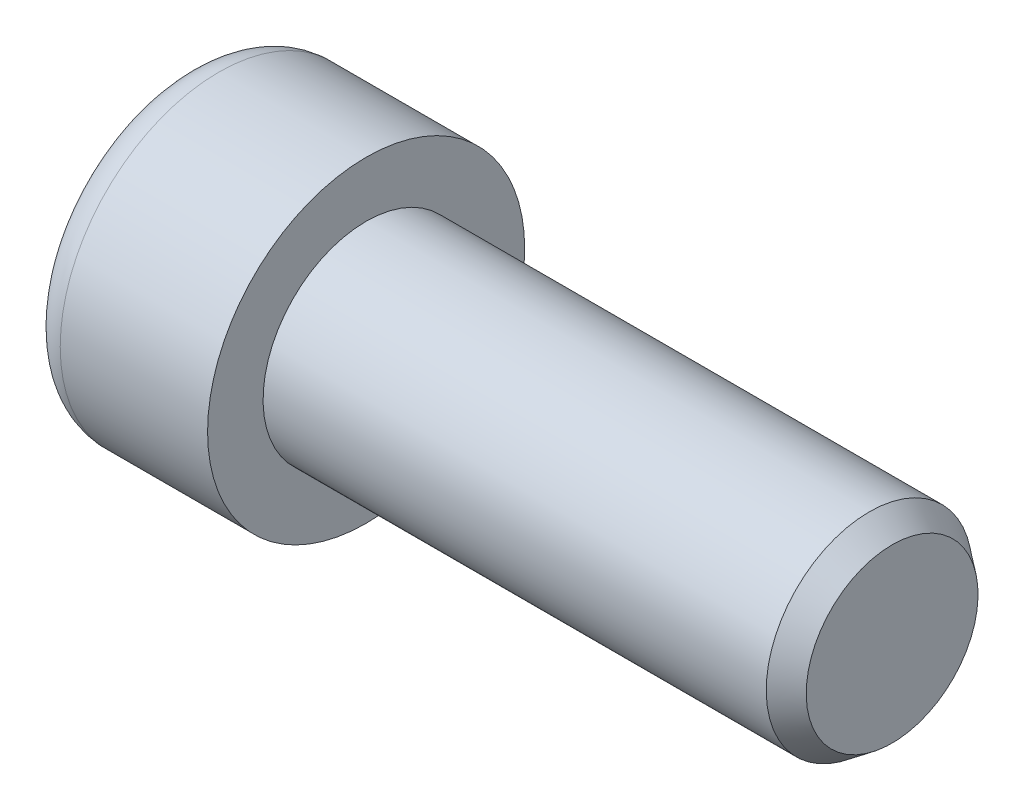
from build123d import *

# Parameters (mm, degrees)
ENL_V_MAT_EXTRU_1_DEPTH = 3
CONG_1_R                = 1


with BuildPart() as part:
    # Esquisse1 → Révolution1 (revolve)
    with BuildSketch(Plane(origin=(0, 331.163762518, 486.544521424), x_dir=(1, 0, 0), z_dir=(-2.1801348268776946e-15, -0.26285670928101523, -0.9648348824467097))):
        Polygon((-260.2005836, 66.110103574), (-260.2005836, 68.610660843), (-260.864838185, 69.110103574), (-275.510043652, 69.110103574), (-275.510043652, 70.725166096), (-280.798930196, 70.725166096), (-280.798930196, 66.110103574), align=None)
    revolve(axis=Axis((-255.510043652, 267.378428507, 503.922005699), (-1, 0, 0)))

    # Esquisse2 → Enlèv. mat.-Extru.1 (cut)
    with BuildSketch(Plane.ZY.offset(280.798930196)):
        Polygon((506.151783926, 267.979612665), (504.51625406, 269.610065175), (502.286475833, 269.008881018), (501.692227472, 266.777244349), (503.327757339, 265.146791839), (505.557535566, 265.747975996), align=None)
    extrude(amount=-ENL_V_MAT_EXTRU_1_DEPTH, mode=Mode.SUBTRACT)

    # Congé1
    cong_1_edges = [part.edges().sort_by_distance(p)[0] for p in [
        (-280.798930196, 271.831201812, 502.708905552),
    ]]
    fillet(cong_1_edges, radius=CONG_1_R)


solid = part.part
